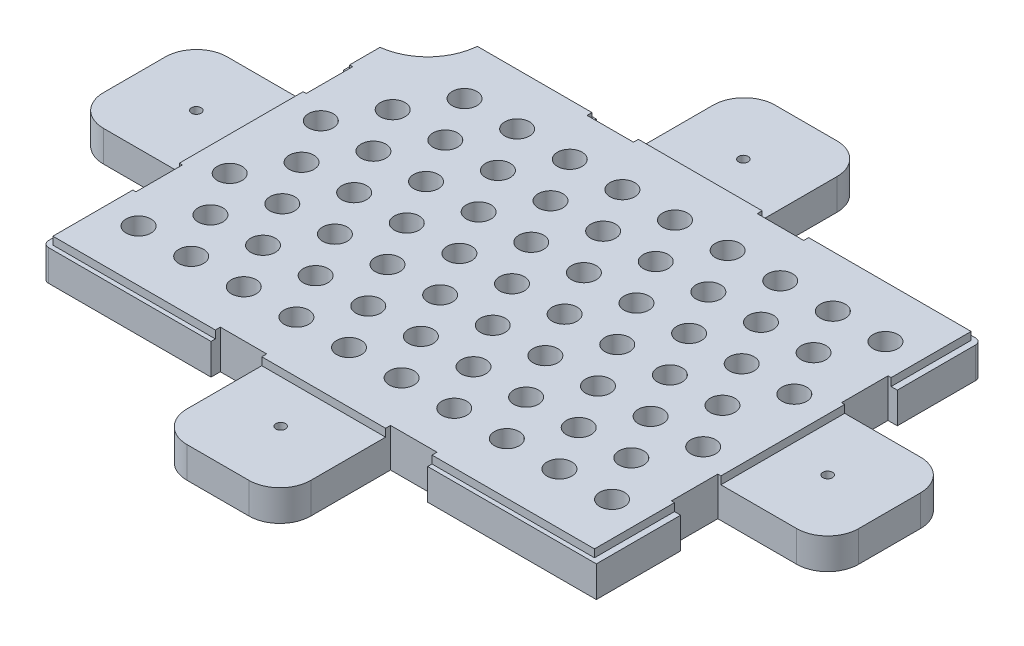
from build123d import *

# Parameters (mm, degrees)
SKETCH1_W               = 32.5
SKETCH1_H               = 40
SKETCH1_R               = 1.55
SKETCH1_W_2             = 40
SKETCH1_H_2             = 32.75
BOSS_EXTRUDE1_DEPTH     = 10
BOSS_EXTRUDE2_DEPTH     = 12.5
SKETCH3_R               = 4
CUT_EXTRUDE1_DEPTH      = 12.5
FILL_PATTERN1_OUTLINE_R = 4
FILL_PATTERN1_DEPTH     = 12.5
FILLET1_R               = 10
FILLET2_R               = 2


# Read off the part's stored shape, not the designer's step: Fill Pattern1
with BuildPart() as part:
    # Sketch1 → Boss-Extrude1 (new body)
    # profile 1 of 9: a face of its own
    with BuildSketch(Plane(origin=(0, 0, 0), x_dir=(1, 0, 0), z_dir=(0, 1, 0))):
        with BuildLine():
            Line((-35, 62.25), (-72, 62.25))
            ThreePointArc((-72, 62.25), (-77.125631329, 49.875631329), (-89.5, 44.75))
            Line((-89.5, 44.75), (-89.5, 35))
            Line((-89.5, 35), (-86.5, 35))
            Line((-86.5, 35), (-86.5, 20))
            Line((-86.5, 20), (-57, 20))
            Line((-57, 20), (-57, -20))
            Line((-57, -20), (-86.5, -20))
            Line((-86.5, -20), (-86.5, -35))
            Line((-86.5, -35), (-89.5, -35))
            Line((-89.5, -35), (-89.5, -62.25))
            Line((-89.5, -62.25), (-35, -62.25))
            Line((-35, -62.25), (-35, -59.25))
            Line((-35, -59.25), (-20, -59.25))
            Line((-20, -59.25), (-20, -29.5))
            Line((-20, -29.5), (20, -29.5))
            Line((20, -29.5), (20, -59.25))
            Line((20, -59.25), (35, -59.25))
            Line((35, -59.25), (35, -62.25))
            Line((35, -62.25), (89.5, -62.25))
            Line((89.5, -62.25), (89.5, -35))
            Line((89.5, -35), (86.5, -35))
            Line((86.5, -35), (86.5, -20))
            Line((86.5, -20), (57, -20))
            Line((57, -20), (57, 20))
            Line((57, 20), (86.5, 20))
            Line((86.5, 20), (86.5, 35))
            Line((86.5, 35), (89.5, 35))
            Line((89.5, 35), (89.5, 62.25))
            Line((89.5, 62.25), (35, 62.25))
            Line((35, 62.25), (35, 59.25))
            Line((35, 59.25), (20, 59.25))
            Line((20, 59.25), (20, 29.5))
            Line((20, 29.5), (-20, 29.5))
            Line((-20, 29.5), (-20, 59.25))
            Line((-20, 59.25), (-35, 59.25))
            Line((-35, 59.25), (-35, 62.25))
        make_face()
    # profile 2 of 9: a face of its own
    with BuildSketch(Plane(origin=(0, 0, 0), x_dir=(1, 0, 0), z_dir=(0, 1, 0))):
        Polygon((89.5, -20), (89.5, 20), (86.5, 20), (57, 20), (57, -20), (86.5, -20), align=None)
    # profile 3 of 9: a face of its own
    with BuildSketch(Plane(origin=(0, 0, 0), x_dir=(1, 0, 0), z_dir=(0, 1, 0))):
        with Locations((105.75, 0)):
            Rectangle(SKETCH1_W, SKETCH1_H)
        with Locations(Location((102, 0, 0), (0, 0, 270))):
            Circle(SKETCH1_R, mode=Mode.SUBTRACT)
    # profile 4 of 9: a face of its own
    with BuildSketch(Plane(origin=(0, 0, 0), x_dir=(1, 0, 0), z_dir=(0, 1, 0))):
        Polygon((-20, -29.5), (-20, -59.25), (-20, -62.25), (20, -62.25), (20, -59.25), (20, -29.5), align=None)
    # profile 5 of 9: a face of its own
    with BuildSketch(Plane(origin=(0, 0, 0), x_dir=(1, 0, 0), z_dir=(0, 1, 0))):
        with Locations((0, -78.625)):
            Rectangle(SKETCH1_W_2, SKETCH1_H_2)
        with Locations(Location((0, -74.75, 0), (0, 0, 270))):
            Circle(SKETCH1_R, mode=Mode.SUBTRACT)
    # profile 6 of 9: a face of its own
    with BuildSketch(Plane(origin=(0, 0, 0), x_dir=(1, 0, 0), z_dir=(0, 1, 0))):
        Polygon((-86.5, 20), (-89.5, 20), (-89.5, -20), (-86.5, -20), (-57, -20), (-57, 20), align=None)
    # profile 7 of 9: a face of its own
    with BuildSketch(Plane(origin=(0, 0, 0), x_dir=(1, 0, 0), z_dir=(0, 1, 0))):
        with Locations((-105.75, 0)):
            Rectangle(SKETCH1_W, SKETCH1_H)
        with Locations(Location((-102, 0, 0), (0, 0, 270))):
            Circle(SKETCH1_R, mode=Mode.SUBTRACT)
    # profile 8 of 9: a face of its own
    with BuildSketch(Plane(origin=(0, 0, 0), x_dir=(1, 0, 0), z_dir=(0, 1, 0))):
        Polygon((20, 62.25), (-20, 62.25), (-20, 59.25), (-20, 29.5), (20, 29.5), (20, 59.25), align=None)
    # profile 9 of 9: a face of its own
    with BuildSketch(Plane(origin=(0, 0, 0), x_dir=(1, 0, 0), z_dir=(0, 1, 0))):
        with Locations((0, 78.625)):
            Rectangle(SKETCH1_W_2, SKETCH1_H_2)
        with Locations(Location((0, 74.75, 0), (0, 0, 270))):
            Circle(SKETCH1_R, mode=Mode.SUBTRACT)
    extrude(amount=BOSS_EXTRUDE1_DEPTH)

    # Sketch2 → Boss-Extrude2 (add)
    with BuildSketch(Plane(origin=(0, 0, 0), x_dir=(1, 0, 0), z_dir=(0, 1, 0))):
        with BuildLine():
            Line((35, -60.85), (87.5, -60.85))
            Line((87.5, -60.85), (87.5, -35))
            Line((87.5, -35), (86.5, -35))
            Line((86.5, -35), (86.5, -20))
            Line((86.5, -20), (87.5, -20))
            Line((87.5, -20), (87.5, 20))
            Line((87.5, 20), (86.5, 20))
            Line((86.5, 20), (86.5, 35))
            Line((86.5, 35), (87.5, 35))
            Line((87.5, 35), (87.5, 60.85))
            Line((87.5, 60.85), (35, 60.85))
            Line((35, 60.85), (35, 59.25))
            Line((35, 59.25), (20, 59.25))
            Line((20, 59.25), (20, 60.85))
            Line((20, 60.85), (-20, 60.85))
            Line((-20, 60.85), (-20, 59.25))
            Line((-20, 59.25), (-35, 59.25))
            Line((-35, 59.25), (-35, 60.85))
            Line((-35, 60.85), (-72.056089888, 60.85))
            ThreePointArc((-72.056089888, 60.85), (-76.914326674, 50.09060746), (-87.5, 44.864661349))
            Line((-87.5, 44.864661349), (-87.5, 35))
            Line((-87.5, 35), (-86.5, 35))
            Line((-86.5, 35), (-86.5, 20))
            Line((-86.5, 20), (-87.5, 20))
            Line((-87.5, 20), (-87.5, -20))
            Line((-87.5, -20), (-86.5, -20))
            Line((-86.5, -20), (-86.5, -35))
            Line((-86.5, -35), (-87.5, -35))
            Line((-87.5, -35), (-87.5, -60.85))
            Line((-87.5, -60.85), (-35, -60.85))
            Line((-35, -60.85), (-35, -59.25))
            Line((-35, -59.25), (-20, -59.25))
            Line((-20, -59.25), (-20, -60.85))
            Line((-20, -60.85), (20, -60.85))
            Line((20, -60.85), (20, -59.25))
            Line((20, -59.25), (35, -59.25))
            Line((35, -59.25), (35, -60.85))
        make_face()
    extrude(amount=BOSS_EXTRUDE2_DEPTH)

    # Sketch3 → Cut-Extrude1 (cut)
    with BuildSketch(Plane(origin=(0, 12.5, 0), x_dir=(1, 0, 0), z_dir=(0, 1, 0))):
        with Locations(Location((0, 0, 0), (0, 0, 270))):
            Circle(SKETCH3_R)
    extrude(amount=-CUT_EXTRUDE1_DEPTH, mode=Mode.SUBTRACT)

    # Fill Pattern1 outline → Fill Pattern1 (cut)
    with BuildSketch(Plane(origin=(0, 0, 0), x_dir=(1, 0, 0), z_dir=(0, 1, 0))):
        with Locations((76.5, -44.167295593)):
            Circle(FILL_PATTERN1_OUTLINE_R)
        with Locations((34, 29.444863729)):
            Circle(FILL_PATTERN1_OUTLINE_R)
        with Locations((42.5, 44.167295593)):
            Circle(FILL_PATTERN1_OUTLINE_R)
        with Locations((8.5, -44.167295593)):
            Circle(FILL_PATTERN1_OUTLINE_R)
        with Locations((17, -29.444863729)):
            Circle(FILL_PATTERN1_OUTLINE_R)
        with Locations((25.5, -14.722431864)):
            Circle(FILL_PATTERN1_OUTLINE_R)
        with Locations((34, 0)):
            Circle(FILL_PATTERN1_OUTLINE_R)
        with Locations((42.5, 14.722431864)):
            Circle(FILL_PATTERN1_OUTLINE_R)
        with Locations((51, 29.444863729)):
            Circle(FILL_PATTERN1_OUTLINE_R)
        with Locations((-8.5, -44.167295593)):
            Circle(FILL_PATTERN1_OUTLINE_R)
        with Locations((25.5, 44.167295593)):
            Circle(FILL_PATTERN1_OUTLINE_R)
        with Locations((17, 29.444863729)):
            Circle(FILL_PATTERN1_OUTLINE_R)
        with Locations((8.5, 14.722431864)):
            Circle(FILL_PATTERN1_OUTLINE_R)
        with Locations((0, -29.444863729)):
            Circle(FILL_PATTERN1_OUTLINE_R)
        with Locations((8.5, -14.722431864)):
            Circle(FILL_PATTERN1_OUTLINE_R)
        with Locations((17, 0)):
            Circle(FILL_PATTERN1_OUTLINE_R)
        with Locations((25.5, 14.722431864)):
            Circle(FILL_PATTERN1_OUTLINE_R)
        with Locations((42.5, -44.167295593)):
            Circle(FILL_PATTERN1_OUTLINE_R)
        with Locations((51, -29.444863729)):
            Circle(FILL_PATTERN1_OUTLINE_R)
        with Locations((59.5, -14.722431864)):
            Circle(FILL_PATTERN1_OUTLINE_R)
        with Locations((68, 0)):
            Circle(FILL_PATTERN1_OUTLINE_R)
        with Locations((76.5, -14.722431864)):
            Circle(FILL_PATTERN1_OUTLINE_R)
        with Locations((68, -29.444863729)):
            Circle(FILL_PATTERN1_OUTLINE_R)
        with Locations((59.5, -44.167295593)):
            Circle(FILL_PATTERN1_OUTLINE_R)
        with Locations((76.5, 14.722431864)):
            Circle(FILL_PATTERN1_OUTLINE_R)
        with Locations((42.5, -14.722431864)):
            Circle(FILL_PATTERN1_OUTLINE_R)
        with Locations((34, -29.444863729)):
            Circle(FILL_PATTERN1_OUTLINE_R)
        with Locations((25.5, -44.167295593)):
            Circle(FILL_PATTERN1_OUTLINE_R)
        with Locations((59.5, 44.167295593)):
            Circle(FILL_PATTERN1_OUTLINE_R)
        with Locations((51, 0)):
            Circle(FILL_PATTERN1_OUTLINE_R)
        with Locations((59.5, 14.722431864)):
            Circle(FILL_PATTERN1_OUTLINE_R)
        with Locations((68, 29.444863729)):
            Circle(FILL_PATTERN1_OUTLINE_R)
        with Locations((76.5, 44.167295593)):
            Circle(FILL_PATTERN1_OUTLINE_R)
        with Locations((-76.5, -44.167295593)):
            Circle(FILL_PATTERN1_OUTLINE_R)
        with Locations((-68, -29.444863729)):
            Circle(FILL_PATTERN1_OUTLINE_R)
        with Locations((-59.5, -14.722431864)):
            Circle(FILL_PATTERN1_OUTLINE_R)
        with Locations((-51, 0)):
            Circle(FILL_PATTERN1_OUTLINE_R)
        with Locations((-59.5, -44.167295593)):
            Circle(FILL_PATTERN1_OUTLINE_R)
        with Locations((-25.5, 44.167295593)):
            Circle(FILL_PATTERN1_OUTLINE_R)
        with Locations((-34, 29.444863729)):
            Circle(FILL_PATTERN1_OUTLINE_R)
        with Locations((-42.5, 14.722431864)):
            Circle(FILL_PATTERN1_OUTLINE_R)
        with Locations((-76.5, -14.722431864)):
            Circle(FILL_PATTERN1_OUTLINE_R)
        with Locations((-59.5, 44.167295593)):
            Circle(FILL_PATTERN1_OUTLINE_R)
        with Locations((-68, 29.444863729)):
            Circle(FILL_PATTERN1_OUTLINE_R)
        with Locations((-76.5, 14.722431864)):
            Circle(FILL_PATTERN1_OUTLINE_R)
        with Locations((-68, 0)):
            Circle(FILL_PATTERN1_OUTLINE_R)
        with Locations((-59.5, 14.722431864)):
            Circle(FILL_PATTERN1_OUTLINE_R)
        with Locations((-51, 29.444863729)):
            Circle(FILL_PATTERN1_OUTLINE_R)
        with Locations((-42.5, 44.167295593)):
            Circle(FILL_PATTERN1_OUTLINE_R)
        with Locations((-25.5, -14.722431864)):
            Circle(FILL_PATTERN1_OUTLINE_R)
        with Locations((-17, 0)):
            Circle(FILL_PATTERN1_OUTLINE_R)
        with Locations((-8.5, 14.722431864)):
            Circle(FILL_PATTERN1_OUTLINE_R)
        with Locations((0, 29.444863729)):
            Circle(FILL_PATTERN1_OUTLINE_R)
        with Locations((-8.5, -14.722431864)):
            Circle(FILL_PATTERN1_OUTLINE_R)
        with Locations((-17, -29.444863729)):
            Circle(FILL_PATTERN1_OUTLINE_R)
        with Locations((-25.5, -44.167295593)):
            Circle(FILL_PATTERN1_OUTLINE_R)
        with Locations((8.5, 44.167295593)):
            Circle(FILL_PATTERN1_OUTLINE_R)
        with Locations((-51, -29.444863729)):
            Circle(FILL_PATTERN1_OUTLINE_R)
        with Locations((-42.5, -14.722431864)):
            Circle(FILL_PATTERN1_OUTLINE_R)
        with Locations((-34, 0)):
            Circle(FILL_PATTERN1_OUTLINE_R)
        with Locations((-25.5, 14.722431864)):
            Circle(FILL_PATTERN1_OUTLINE_R)
        with Locations((-17, 29.444863729)):
            Circle(FILL_PATTERN1_OUTLINE_R)
        with Locations((-8.5, 44.167295593)):
            Circle(FILL_PATTERN1_OUTLINE_R)
        with Locations((-42.5, -44.167295593)):
            Circle(FILL_PATTERN1_OUTLINE_R)
        with Locations((-34, -29.444863729)):
            Circle(FILL_PATTERN1_OUTLINE_R)
    extrude(amount=FILL_PATTERN1_DEPTH, mode=Mode.SUBTRACT)

    # Fillet1
    fillet1_edges = [part.edges().sort_by_distance(p)[0] for p in [
        (-122, 5, 20),
        (-122, 5, -20),
        (-20, 5, -95),
        (20, 5, -95),
        (122, 5, -20),
        (122, 5, 20),
        (20, 5, 95),
        (-20, 5, 95),
    ]]
    fillet(fillet1_edges, radius=FILLET1_R)

    # Fillet2
    fillet2_edges = [part.edges().sort_by_distance(p)[0] for p in [
        (-89.5, 5, 62.25),
        (-89.5, 5, -44.75),
        (-72, 5, -62.25),
        (89.5, 5, -62.25),
    ]]
    fillet(fillet2_edges, radius=FILLET2_R)


solid = part.part
